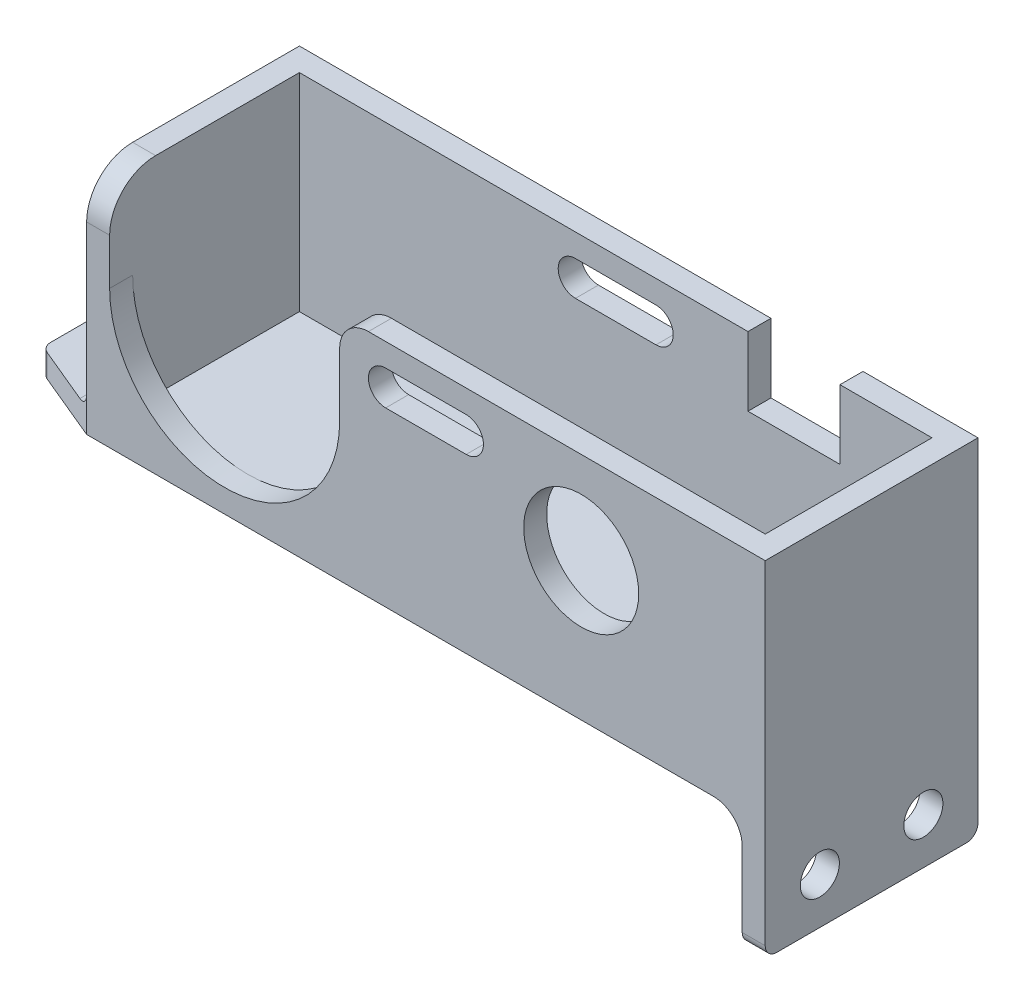
from build123d import *

# Parameters (mm, degrees)
SKETCH1_W               = 55
SKETCH1_H               = 18
BOSS_EXTRUDE1_DEPTH     = 7.25
SHELL2_T                = 2
LENS_CUTOUT_REACH       = 38.517
POWER_BUTTON_HOLE_REACH = 38.517
SKETCH12_R              = 5
POWER_CORD_CUTOUT_REACH = 38.517
SKETCH13_W              = 8
SKETCH13_H              = 6
CUT_EXTRUDE4_DEPTH      = 37.517119273
FILLET4_R               = 2.5
BOSS_EXTRUDE3_DEPTH     = 2
M3_CLEARANCE_HOLE1_D    = 3.4
FILLET2_R               = 1
SKETCH18_W              = 2
SKETCH18_H              = 18.5
BOSS_EXTRUDE4_DEPTH     = 10
M3_CLEARANCE_HOLE2_D    = 3.4
FILLET3_R               = 2.5
FILLET5_R               = 4
FILLET6_R               = 1


with BuildPart() as part:
    # Sketch1 → Boss-Extrude1 (new, symmetric)
    with BuildSketch(Plane.XY):
        Rectangle(SKETCH1_W, SKETCH1_H)
    extrude(amount=BOSS_EXTRUDE1_DEPTH, both=True)

    # Shell2
    shell2_openings = [part.faces().sort_by_distance(p)[0] for p in [
        (0, 9, 0),
    ]]
    offset(amount=SHELL2_T, openings=shell2_openings, kind=Kind.INTERSECTION)

    # Sketch11 → lens cutout (cut, up to next)
    with BuildSketch(Plane.XY.offset(9.25), mode=Mode.PRIVATE) as lens_cutout_sk1:
        with BuildLine():
            Line((-27.5, 9), (-27.5, 1))
            ThreePointArc((-27.5, 1), (-17.5, -9), (-7.5, 1))
            Line((-7.5, 1), (-7.5, 9))
            Line((-7.5, 9), (-27.5, 9))
        make_face()
    lens_cutout_tool1 = extrude(lens_cutout_sk1.sketch, amount=-LENS_CUTOUT_REACH, mode=Mode.PRIVATE) & part.part
    add(lens_cutout_tool1.solids().sort_by_distance((-17.5, 0.915899, 9.25))[0], mode=Mode.SUBTRACT)

    # Sketch12 → power button hole (cut, up to next)
    with BuildSketch(Plane.XY.offset(9.25), mode=Mode.PRIVATE) as power_button_hole_sk1:
        with Locations((13.5, 1)):
            Circle(SKETCH12_R)
    power_button_hole_tool1 = extrude(power_button_hole_sk1.sketch, amount=-POWER_BUTTON_HOLE_REACH, mode=Mode.PRIVATE) & part.part
    add(power_button_hole_tool1.solids().sort_by_distance((13.5, 1, 9.25))[0], mode=Mode.SUBTRACT)

    # Sketch13 → power cord cutout (cut, up to next)
    with BuildSketch(Plane(origin=(0, 0, -9.25), x_dir=(-1, 0, 0), z_dir=(0, 0, -1)), mode=Mode.PRIVATE) as power_cord_cutout_sk1:
        with Locations((-15.5, 6)):
            Rectangle(SKETCH13_W, SKETCH13_H)
    power_cord_cutout_tool1 = extrude(power_cord_cutout_sk1.sketch, amount=-POWER_CORD_CUTOUT_REACH, mode=Mode.PRIVATE) & part.part
    add(power_cord_cutout_tool1.solids().sort_by_distance((15.5, 6, -9.25))[0], mode=Mode.SUBTRACT)

    # Sketch21 → Cut-Extrude4 (cut, through all)
    with BuildSketch(Plane.XY.offset(9.25)):
        with BuildLine():
            Line((-3.5, 7), (3.5, 7))
            ThreePointArc((3.5, 7), (5, 5.5), (3.5, 4))
            Line((3.5, 4), (-3.5, 4))
            ThreePointArc((-3.5, 4), (-5, 5.5), (-3.5, 7))
        make_face()
    extrude(amount=-CUT_EXTRUDE4_DEPTH, mode=Mode.SUBTRACT)

    # Fillet4
    fillet4_edges = [part.edges().sort_by_distance(p)[0] for p in [
        (-7.5, 9, 8.25),
    ]]
    fillet(fillet4_edges, radius=FILLET4_R)

    # Sketch15 → Boss-Extrude3 (add)
    with BuildSketch(Plane.XZ.offset(11)):
        Polygon((-29.5, 9.25), (-29.5, -9.25), (-36, -11.96461114), (-36, 6.53538886), align=None)
    extrude(amount=-BOSS_EXTRUDE3_DEPTH)

    # M3 Clearance Hole1 (through all)
    with Locations(Plane(origin=(0, -9, 0), x_dir=(1, 0, 0), z_dir=(0, 1, 0))):
        with Locations((-32.75, 1.35730557)):
            Hole(M3_CLEARANCE_HOLE1_D / 2)

    # Fillet2
    fillet2_edges = [part.edges().sort_by_distance(p)[0] for p in [
        (-29.5, -9, 0),
    ]]
    fillet(fillet2_edges, radius=FILLET2_R)

    # Sketch18 → Boss-Extrude4 (add)
    with BuildSketch(Plane.XZ.offset(11)):
        with Locations((28.5, 0)):
            Rectangle(SKETCH18_W, SKETCH18_H)
    extrude(amount=BOSS_EXTRUDE4_DEPTH)

    # M3 Clearance Hole2 (through all)
    with Locations(Plane.ZY.offset(-27.5)):
        with Locations((-4.5, -17), (4.5, -17)):
            Hole(M3_CLEARANCE_HOLE2_D / 2)

    # Fillet3
    fillet3_edges = [part.edges().sort_by_distance(p)[0] for p in [
        (27.5, -11, 0),
    ]]
    fillet(fillet3_edges, radius=FILLET3_R)

    # Fillet5
    fillet5_edges = [part.edges().sort_by_distance(p)[0] for p in [
        (-28.5, 9, 9.25),
    ]]
    fillet(fillet5_edges, radius=FILLET5_R)

    # Fillet6
    fillet6_edges = [part.edges().sort_by_distance(p)[0] for p in [
        (28.5, -21, -9.25),
        (28.5, -21, 9.25),
        (-36, -10, -11.96461114),
        (-36, -10, 6.53538886),
    ]]
    fillet(fillet6_edges, radius=FILLET6_R)


solid = part.part
